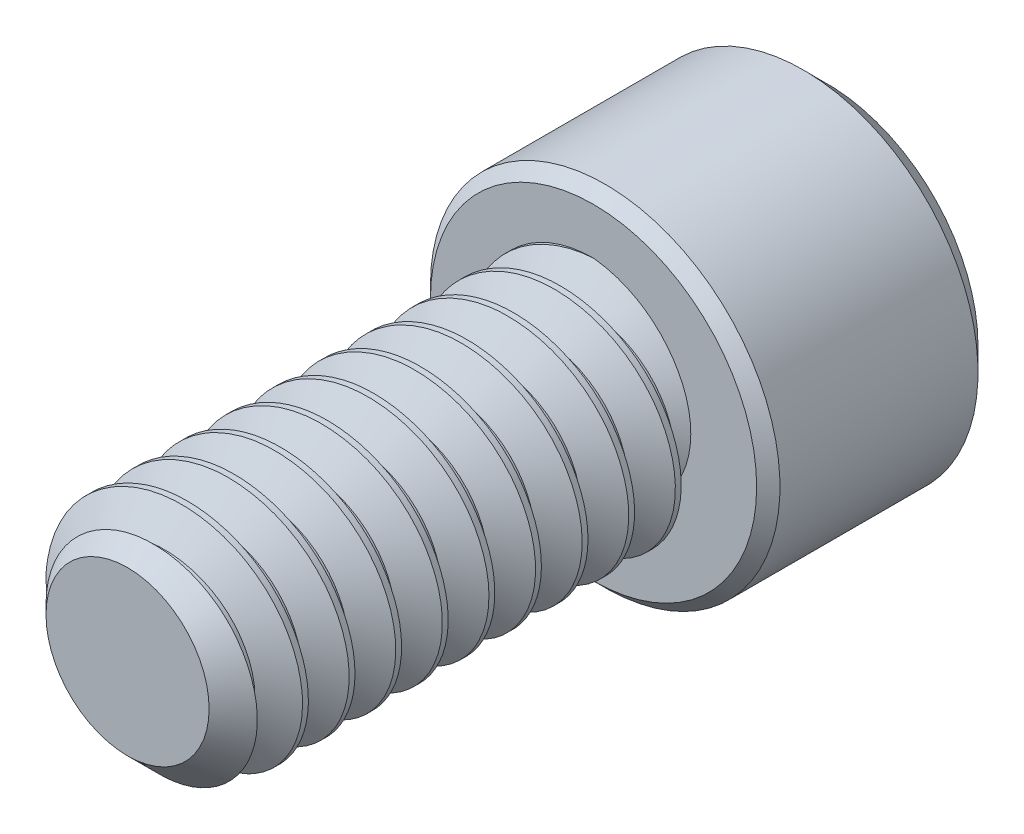
from build123d import *

# Parameters (mm, degrees)
SKETCH1_R          = 3.175
EXTRUDE1_DEPTH     = 12.7
CHAMFER3_SIZE      = 0.9525
CUT_SWEEP1_PITCH   = 1.27
SKETCH6_R          = 4.7625
EXTRUDE2_DEPTH     = 6.35
CUT_EXTRUDE1_DEPTH = 3.571875
SKETCH8_R          = 2.749630657
CUT_EXTRUDE2_DEPTH = 0.635
CUT_EXTRUDE2_DRAFT = -45
CHAMFER1_SIZE      = 0.635
CHAMFER2_SIZE      = 0.3175


with BuildPart() as part:
    # Sketch1 → Extrude1 (new body)
    with BuildSketch(Plane.XY):
        Circle(SKETCH1_R)
    extrude(amount=-EXTRUDE1_DEPTH)

    # Chamfer3
    chamfer3_edges = [part.edges().sort_by_distance(p)[0] for p in [
        (-3.175, 0, 0),
    ]]
    chamfer(chamfer3_edges, length=CHAMFER3_SIZE)

    # Cut-Sweep1: the profile of Sketch3 profile screwed along a right-hand helix of 11 turns, 6 arcs to a turn; built about Z, then put on its axis
    cut_sweep1_z = Axis((0, 0, 0), (0, 0, 1))
    cut_sweep1_corners = [(3.1753, 0, -1.111423205), (2.350110803, 0, -0.635), (2.350110803, 0, -0.47625), (3.1753, 0, 0.000173205)]
    with BuildLine(mode=Mode.PRIVATE) as cut_sweep1_profile:
        Line(cut_sweep1_corners[0], cut_sweep1_corners[1])
        Line(cut_sweep1_corners[1], cut_sweep1_corners[2])
        Line(cut_sweep1_corners[2], cut_sweep1_corners[3])
        Line(cut_sweep1_corners[3], cut_sweep1_corners[0])
    cut_sweep1_cap = Face(cut_sweep1_profile.wire())
    cut_sweep1_turn_angles = [0, 30, 60, 90, 120, 150, 180, 210, 240, 270, 300, 330, 360]
    cut_sweep1_turn_weights = [1, 0.8660254037844387, 1, 0.8660254037844387, 1, 0.8660254037844387, 1, 0.8660254037844387, 1, 0.8660254037844387, 1, 0.8660254037844387, 1]
    cut_sweep1_turn_rails = [Edge.make_bspline([Vector(p[0], p[1], 0).rotate(cut_sweep1_z, cut_sweep1_turn_angles[k]) / cut_sweep1_turn_weights[k] + Vector(0, 0, p[2] + CUT_SWEEP1_PITCH * cut_sweep1_turn_angles[k] / 360) for k in range(13)], [0, 0, 0, 1, 1, 2, 2, 3, 3, 4, 4, 5, 5, 6, 6, 6], 2, cut_sweep1_turn_weights) for p in cut_sweep1_corners]
    cut_sweep1_turn_sides = [Face.make_surface_from_curves(cut_sweep1_turn_rails[p[0]], cut_sweep1_turn_rails[p[1]]) for p in [(0, 1), (1, 2), (2, 3), (3, 0)]]
    cut_sweep1 = Plane(origin=(0, 0, 0), x_dir=(0, 1, 0), z_dir=(0, 0, -1)) * Solid(Shell([*[p.moved(Location((0, 0, CUT_SWEEP1_PITCH * i))) for i in range(11) for p in cut_sweep1_turn_sides], cut_sweep1_cap, cut_sweep1_cap.rotate(cut_sweep1_z, 3960).moved(Location((0, 0, CUT_SWEEP1_PITCH * 3960 / 360)))]))
    add(cut_sweep1, mode=Mode.SUBTRACT)

    # Sketch6 → Extrude2 (add)
    with BuildSketch(Plane(origin=(0, 0, -12.7), x_dir=(-1, 0, 0), z_dir=(0, 0, -1))):
        Circle(SKETCH6_R)
    extrude(amount=EXTRUDE2_DEPTH)

    # Sketch7 → Cut-Extrude1 (cut)
    with BuildSketch(Plane(origin=(0, 0, -19.05), x_dir=(-1, 0, 0), z_dir=(0, 0, -1))):
        Polygon((0, 2.749630657), (-2.38125, 1.374815329), (-2.38125, -1.374815329), (0, -2.749630657), (2.38125, -1.374815329), (2.38125, 1.374815329), align=None)
    extrude(amount=-CUT_EXTRUDE1_DEPTH, mode=Mode.SUBTRACT)


with BuildPart() as cut_extrude2_tool:
    # Sketch8 → Cut-Extrude2 (with draft: the straight prism first)
    with BuildSketch(Plane(origin=(0, 0, -19.05), x_dir=(-1, 0, 0), z_dir=(0, 0, -1))):
        Circle(SKETCH8_R)
    extrude(amount=-CUT_EXTRUDE2_DEPTH)
    # Cut-Extrude2: the draft: its side faces are tilted about the plane it starts from
    cut_extrude2_sides = [cut_extrude2_tool.faces().sort_by_distance(p)[0] for p in [
        (2.749630657, 0, -18.7325),
    ]]
    draft(cut_extrude2_sides, Plane(origin=(0, 0, -19.05), x_dir=(-1, 0, 0), z_dir=(0, 0, -1)), CUT_EXTRUDE2_DRAFT)


with BuildPart() as part_1:
    add(part.part)

    # Cut-Extrude2: cut by cut_extrude2_tool
    add(cut_extrude2_tool.part, mode=Mode.SUBTRACT)

    # Chamfer1
    chamfer1_edges = [part_1.edges().sort_by_distance(p)[0] for p in [
        (4.7625, 0, -19.05),
    ]]
    chamfer(chamfer1_edges, length=CHAMFER1_SIZE)

    # Chamfer2
    chamfer2_edges = [part_1.edges().sort_by_distance(p)[0] for p in [
        (4.7625, 0, -12.7),
    ]]
    chamfer(chamfer2_edges, length=CHAMFER2_SIZE)


solid = part_1.part
